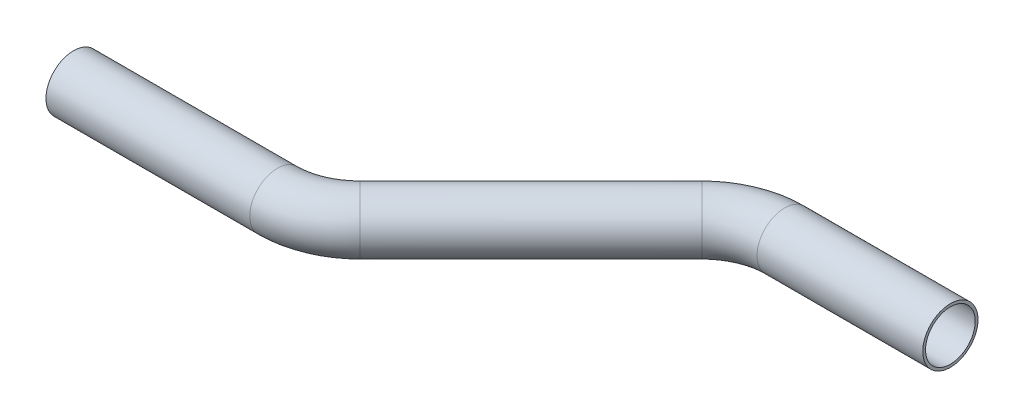
from build123d import *

# Parameters (mm, degrees)
SKETCH2_R   = 6.35
SKETCH2_R_2 = 5.715


with BuildPart() as part:
    # Sweep1: sweep along a path in Sketch1
    with BuildLine(Plane(origin=(0, 0, 0), x_dir=(1, 0, 0), z_dir=(0, 1, 0))) as sweep1_path:
        Line((0, 0), (46.847889241, 0))
        ThreePointArc((46.847889241, 0), (54.138008627, 1.450094906), (60.318273422, 5.579615818))
        Line((60.318273422, 5.579615818), (99.575171586, 44.836513982))
        ThreePointArc((99.575171586, 44.836513982), (105.755436381, 48.966034894), (113.045555767, 50.4161298))
        Line((113.045555767, 50.4161298), (151.145555767, 50.4161298))
    # Sketch2 → Sweep1 (sweep)
    with BuildSketch(Plane(origin=(0, 0, 0), x_dir=(0, 0, -1), z_dir=(1, 0, 0))):
        Circle(SKETCH2_R)
        Circle(SKETCH2_R_2, mode=Mode.SUBTRACT)
    sweep(path=sweep1_path.line)


solid = part.part
